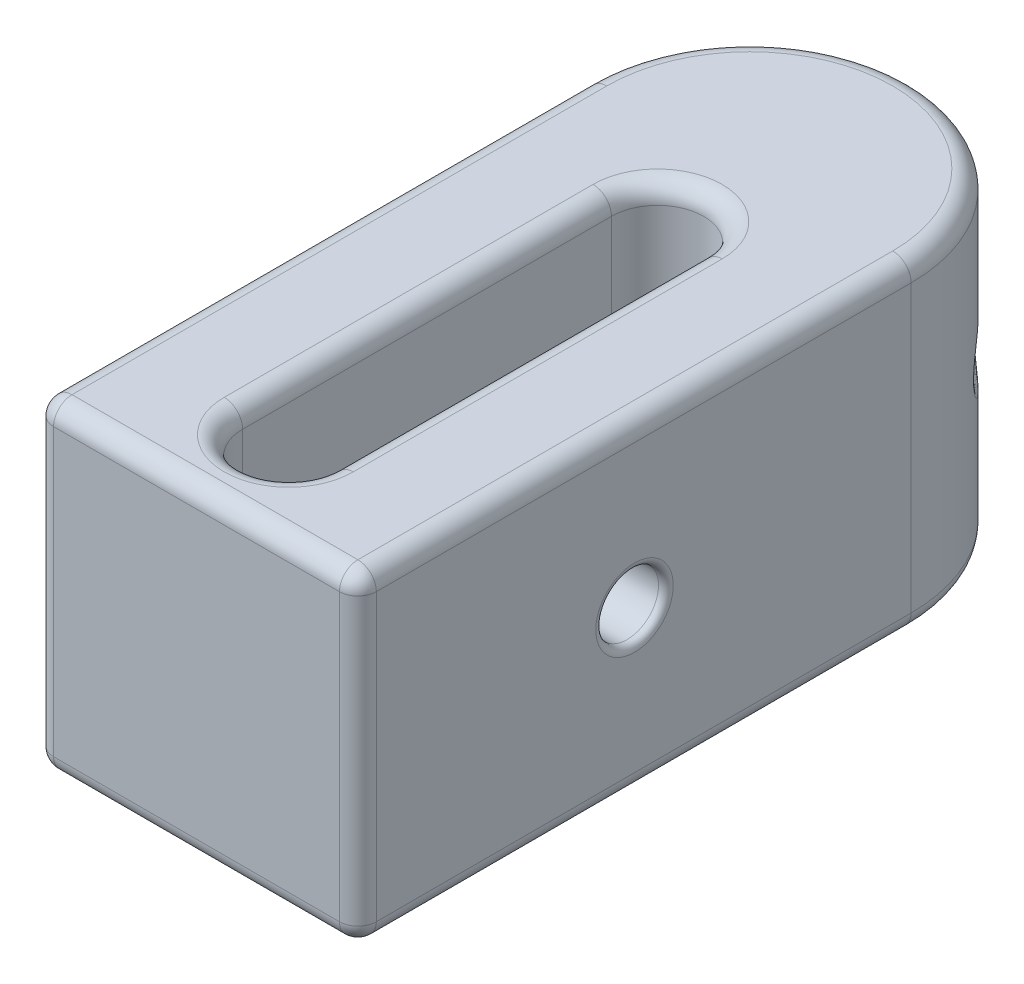
from build123d import *

# Parameters (mm, degrees)
SKETCH1_W                       = 22.225
SKETCH1_H                       = 22.225
BOSS_EXTRUDE1_DEPTH             = 38.1
BOSS_EXTRUDE3_REACH             = 43.214
BOSS_EXTRUDE3_DIRECTION_2_REACH = 43.214
SKETCH4_R                       = 2.159
CUT_EXTRUDE1_DEPTH              = 46.486792383
SKETCH8_R                       = 1.5875
CUT_EXTRUDE3_DEPTH              = 8.89
SKETCH7_R                       = 1.5875
CUT_EXTRUDE4_DEPTH              = 8.89
CUT_EXTRUDE6_DEPTH              = 46.486792456
FILLET1_R                       = 0.508
FILLET14_R                      = 0.508
FILLET15_R                      = 1.27


with BuildPart() as part:
    # Sketch1 → Boss-Extrude1 (new body)
    with BuildSketch(Plane.XY):
        Rectangle(SKETCH1_W, SKETCH1_H)
    extrude(amount=BOSS_EXTRUDE1_DEPTH)

    # Boss-Extrude3: up to this face of the body (flat: up to its plane)
    boss_extrude3_end = Plane(part.part.faces().sort_by_distance((0, 11.1125, 19.05))[0])
    # Sketch3 → Boss-Extrude3 (add, up to the picked face)
    with BuildSketch(Plane(origin=(0, 0, 0), x_dir=(1, 0, 0), z_dir=(0, 1, 0)), mode=Mode.PRIVATE) as boss_extrude3_sk1:
        with BuildLine():
            Line((-11.1125, 0), (11.1125, 0))
            ThreePointArc((11.1125, 0), (0, 11.1125), (-11.1125, 0))
        make_face()
    boss_extrude3_tool1 = split(extrude(boss_extrude3_sk1.sketch, amount=BOSS_EXTRUDE3_REACH, mode=Mode.PRIVATE), bisect_by=boss_extrude3_end, keep=Keep.BOTH, mode=Mode.PRIVATE)
    add(boss_extrude3_tool1.solids().sort_by(Axis((0, 0, -4.716291), (0, 1, 0)))[0])

    # Boss-Extrude3 direction 2: up to this face of the body (flat: up to its plane)
    boss_extrude3_direction_2_end = Plane(part.part.faces().sort_by_distance((0, -11.1125, 19.05))[0])
    # Sketch3 → Boss-Extrude3 direction 2 (add, up to the picked face)
    with BuildSketch(Plane(origin=(0, 0, 0), x_dir=(1, 0, 0), z_dir=(0, 1, 0)), mode=Mode.PRIVATE) as boss_extrude3_direction_2_sk1:
        with BuildLine():
            Line((-11.1125, 0), (11.1125, 0))
            ThreePointArc((11.1125, 0), (0, 11.1125), (-11.1125, 0))
        make_face()
    boss_extrude3_direction_2_tool1 = split(extrude(boss_extrude3_direction_2_sk1.sketch, amount=-BOSS_EXTRUDE3_DIRECTION_2_REACH, mode=Mode.PRIVATE), bisect_by=boss_extrude3_direction_2_end, keep=Keep.BOTH, mode=Mode.PRIVATE)
    add(boss_extrude3_direction_2_tool1.solids().sort_by(Axis((0, 0, -4.716291), (0, -1, 0)))[0])

    # Sketch4 → Cut-Extrude1 (cut, through all)
    with BuildSketch(Plane(origin=(11.1125, 0, 0), x_dir=(0, 0, -1), z_dir=(1, 0, 0))):
        with Locations((-19.05, 0)):
            Circle(SKETCH4_R)
    extrude(amount=-CUT_EXTRUDE1_DEPTH, mode=Mode.SUBTRACT)

    # Sketch8 → Cut-Extrude3 (cut)
    with BuildSketch(Plane(origin=(7.857724106, 0, -7.857724106), x_dir=(-0.7071067811865515, 0, -0.7071067811865436), z_dir=(0.7071067811865436, 0, -0.7071067811865515))):
        Circle(SKETCH8_R)
    extrude(amount=-CUT_EXTRUDE3_DEPTH, mode=Mode.SUBTRACT)

    # Sketch7 → Cut-Extrude4 (cut)
    with BuildSketch(Plane(origin=(-7.857724106, 0, -7.857724106), x_dir=(0.7071067811865512, 0, -0.7071067811865439), z_dir=(0.7071067811865439, 0, 0.7071067811865512))):
        Circle(SKETCH7_R)
    extrude(amount=CUT_EXTRUDE4_DEPTH, mode=Mode.SUBTRACT)

    # Sketch10 → Cut-Extrude6 (cut, through all)
    with BuildSketch(Plane(origin=(0, -11.1125, 0), x_dir=(-1, 0, 0), z_dir=(0, -1, 0))):
        with BuildLine():
            Line((3.175, -6.35), (3.175, -31.75))
            ThreePointArc((3.175, -31.75), (0, -34.925), (-3.175, -31.75))
            Line((-3.175, -31.75), (-3.175, -6.35))
            ThreePointArc((-3.175, -6.35), (0, -3.175), (3.175, -6.35))
        make_face()
    extrude(amount=-CUT_EXTRUDE6_DEPTH, mode=Mode.SUBTRACT)

    # Fillet1
    fillet1_edges = [part.edges().sort_by_distance(p)[0] for p in [
        (8.89966195, 5e-09, -6.654597918),
        (-8.89966195, 5e-09, -6.654597918),
    ]]
    fillet(fillet1_edges, radius=FILLET1_R)

    # Fillet14
    fillet14_edges = [part.edges().sort_by_distance(p)[0] for p in [
        (11.1125, 0, 21.209),
        (-11.1125, 0, 21.209),
    ]]
    fillet(fillet14_edges, radius=FILLET14_R)

    # Fillet15
    fillet15_edges = [part.edges().sort_by_distance(p)[0] for p in [
        (-11.1125, 0, 38.1),
        (11.1125, 0, 38.1),
        (0, -11.1125, 38.1),
        (11.1125, -11.1125, 19.05),
        (0, -11.1125, -11.1125),
        (-11.1125, -11.1125, 19.05),
        (0, 11.1125, 38.1),
        (-11.1125, 11.1125, 19.05),
        (0, 11.1125, -11.1125),
        (11.1125, 11.1125, 19.05),
        (3.175, -11.1125, 19.05),
        (-3.175, -11.1125, 19.05),
        (0, -11.1125, 3.175),
        (3.175, 11.1125, 19.05),
        (0, 11.1125, 3.175),
        (-3.175, 11.1125, 19.05),
        (0, -11.1125, 34.925),
        (0, 11.1125, 34.925),
    ]]
    fillet(fillet15_edges, radius=FILLET15_R)


solid = part.part
